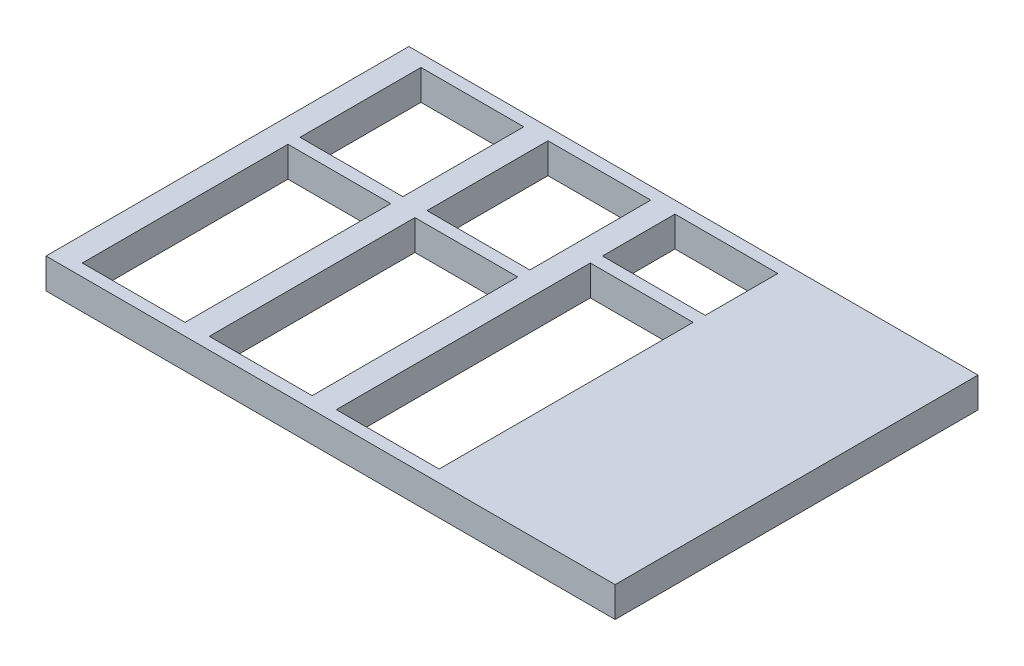
from build123d import *

# Parameters (mm, degrees)
SKETCH1_W           = 94.1
SKETCH1_H           = 60
SKETCH1_W_2         = 17
SKETCH1_H_2         = 34
SKETCH1_H_3         = 20
SKETCH1_H_4         = 42
SKETCH1_H_5         = 12
BOSS_EXTRUDE1_DEPTH = 5


with BuildPart() as part:
    # Sketch1 → Boss-Extrude1 (new body)
    with BuildSketch(Plane(origin=(0, 0, 0), x_dir=(1, 0, 0), z_dir=(0, 1, 0))):
        Rectangle(SKETCH1_W, SKETCH1_H)
        with Locations((-34.55, -11)):
            Rectangle(SKETCH1_W_2, SKETCH1_H_2, mode=Mode.SUBTRACT)
        with Locations((-34.55, 18)):
            Rectangle(SKETCH1_W_2, SKETCH1_H_3, mode=Mode.SUBTRACT)
        with Locations((-13.55, -11)):
            Rectangle(SKETCH1_W_2, SKETCH1_H_2, mode=Mode.SUBTRACT)
        with Locations((-13.55, 18)):
            Rectangle(SKETCH1_W_2, SKETCH1_H_3, mode=Mode.SUBTRACT)
        with Locations((7.45, -7)):
            Rectangle(SKETCH1_W_2, SKETCH1_H_4, mode=Mode.SUBTRACT)
        with Locations((7.45, 22)):
            Rectangle(SKETCH1_W_2, SKETCH1_H_5, mode=Mode.SUBTRACT)
    extrude(amount=BOSS_EXTRUDE1_DEPTH)


solid = part.part
